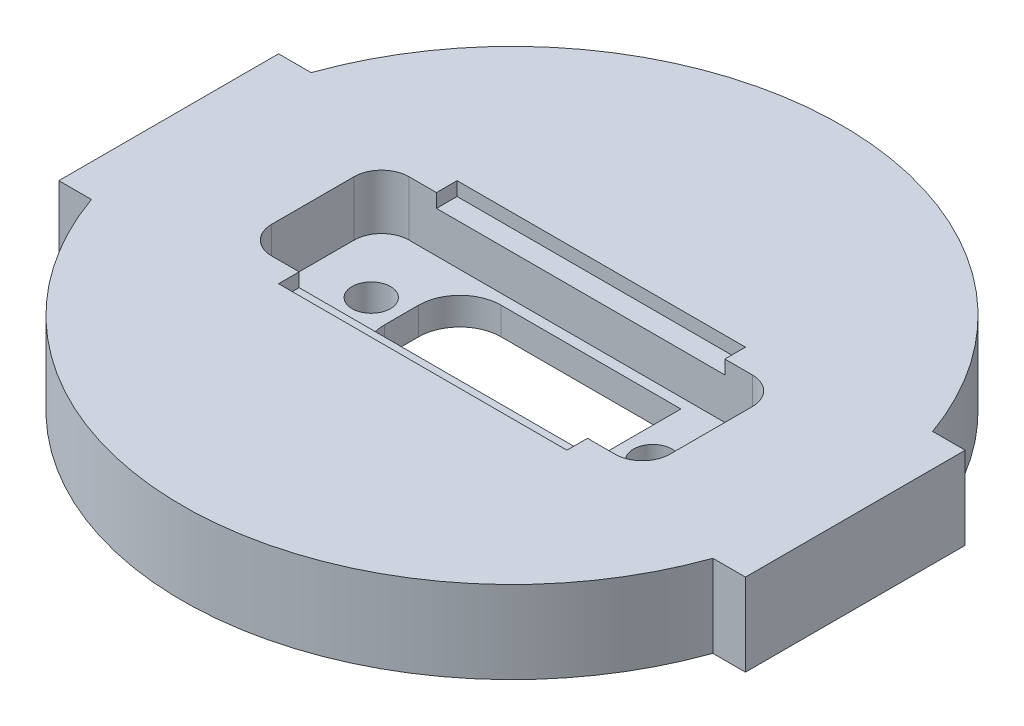
from build123d import *

# Parameters (mm, degrees)
BOSS_EXTRUDE1_DEPTH = 6
CUT_EXTRUDE1_DEPTH  = 10
CUT_EXTRUDE2_DEPTH  = 4
SKETCH4_W           = 21
SKETCH4_H           = 13
CUT_EXTRUDE3_DEPTH  = 1
SKETCH5_R           = 1.4
CUT_EXTRUDE4_DEPTH  = 10


with BuildPart() as part:
    # Sketch1 → Boss-Extrude1 (new body)
    with BuildSketch(Plane(origin=(0, 0, 0), x_dir=(1, 0, 0), z_dir=(0, 1, 0))):
        with BuildLine():
            Line((22.627416998, 8), (25, 8))
            Line((25, 8), (25, -8))
            Line((25, -8), (22.627416998, -8))
            ThreePointArc((22.627416998, -8), (0, -24), (-22.627416998, -8))
            Line((-22.627416998, -8), (-25, -8))
            Line((-25, -8), (-25, 8))
            Line((-25, 8), (-22.627416998, 8))
            ThreePointArc((-22.627416998, 8), (0, 24), (22.627416998, 8))
        make_face()
    extrude(amount=BOSS_EXTRUDE1_DEPTH)

    # Sketch2 → Cut-Extrude1 (cut)
    with BuildSketch(Plane(origin=(0, 6, 0), x_dir=(1, 0, 0), z_dir=(0, 1, 0))):
        with BuildLine():
            Line((-5.05, -4.25), (8.05, -4.25))
            Line((8.05, -4.25), (8.05, 4.25))
            Line((8.05, 4.25), (-5.05, 4.25))
            ThreePointArc((-5.05, 4.25), (-7.171320344, 3.371320344), (-8.05, 1.25))
            Line((-8.05, 1.25), (-8.05, -1.25))
            ThreePointArc((-8.05, -1.25), (-7.171320344, -3.371320344), (-5.05, -4.25))
        make_face()
    extrude(amount=-CUT_EXTRUDE1_DEPTH, mode=Mode.SUBTRACT)

    # Sketch3 → Cut-Extrude2 (cut)
    with BuildSketch(Plane(origin=(0, 6, 0), x_dir=(1, 0, 0), z_dir=(0, 1, 0))):
        with BuildLine():
            Line((-12.5, -5), (12.5, -5))
            ThreePointArc((12.5, -5), (13.914213562, -4.414213562), (14.5, -3))
            Line((14.5, -3), (14.5, 3))
            ThreePointArc((14.5, 3), (13.914213562, 4.414213562), (12.5, 5))
            Line((12.5, 5), (-12.5, 5))
            ThreePointArc((-12.5, 5), (-13.914213562, 4.414213562), (-14.5, 3))
            Line((-14.5, 3), (-14.5, -3))
            ThreePointArc((-14.5, -3), (-13.914213562, -4.414213562), (-12.5, -5))
        make_face()
    extrude(amount=-CUT_EXTRUDE2_DEPTH, mode=Mode.SUBTRACT)

    # Sketch4 → Cut-Extrude3 (cut)
    with BuildSketch(Plane(origin=(0, 6, 0), x_dir=(1, 0, 0), z_dir=(0, 1, 0))):
        Rectangle(SKETCH4_W, SKETCH4_H)
    extrude(amount=-CUT_EXTRUDE3_DEPTH, mode=Mode.SUBTRACT)

    # Sketch5 → Cut-Extrude4 (cut)
    with BuildSketch(Plane(origin=(0, 2, 0), x_dir=(1, 0, 0), z_dir=(0, 1, 0))):
        with Locations((-10.25, 0)):
            Circle(SKETCH5_R)
        with Locations((10.25, 0)):
            Circle(SKETCH5_R)
    extrude(amount=-CUT_EXTRUDE4_DEPTH, mode=Mode.SUBTRACT)


solid = part.part
